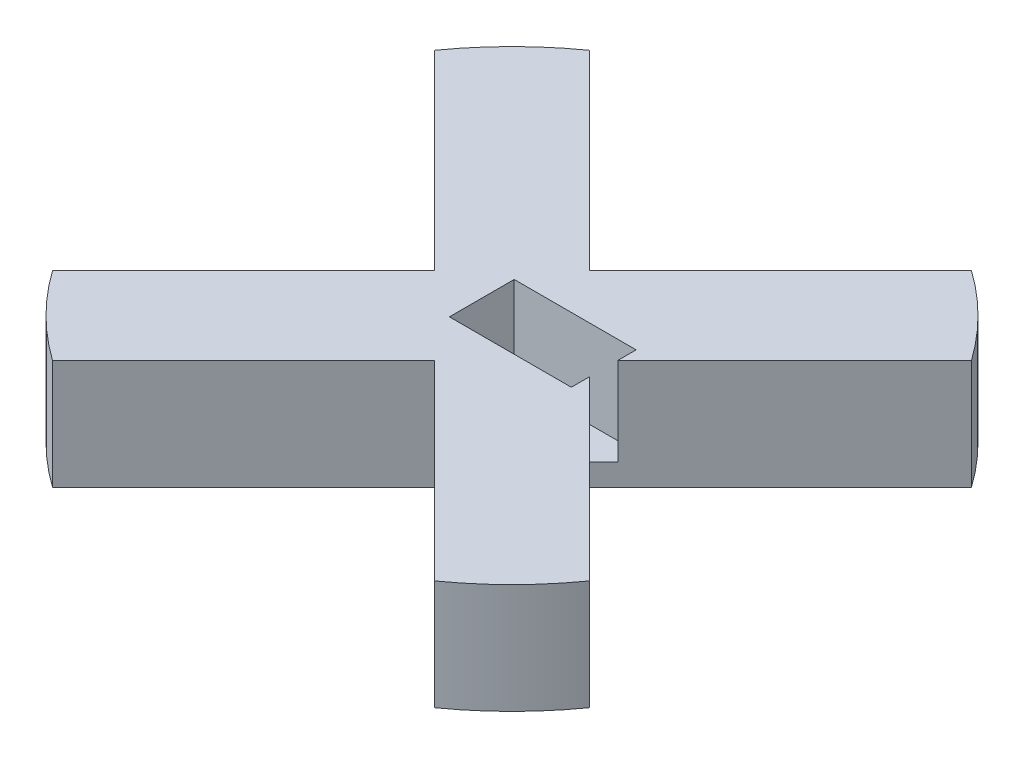
from build123d import *

# Parameters (mm, degrees)
BOSS_EXTRUDE2_DEPTH = 20
SKETCH7_W           = 22.2
SKETCH7_H           = 11.8
CUT_EXTRUDE8_DEPTH  = 16


with BuildPart() as part:
    # Sketch2 → Boss-Extrude2 (new body)
    with BuildSketch(Plane(origin=(0, 0, 0), x_dir=(1, 0, 0), z_dir=(0, 1, 0))):
        with BuildLine():
            Line((14.142135624, 0), (48.904069139, 34.761933515))
            ThreePointArc((48.904069139, 34.761933515), (42.426406871, 42.426406871), (34.761933515, 48.904069139))
            Line((34.761933515, 48.904069139), (0, 14.142135624))
            Line((0, 14.142135624), (-34.761933515, 48.904069139))
            ThreePointArc((-34.761933515, 48.904069139), (-42.426406871, 42.426406871), (-48.904069139, 34.761933515))
            Line((-48.904069139, 34.761933515), (-14.142135624, 0))
            Line((-14.142135624, 0), (-48.904069139, -34.761933515))
            ThreePointArc((-48.904069139, -34.761933515), (-42.426406871, -42.426406871), (-34.761933515, -48.904069139))
            Line((-34.761933515, -48.904069139), (0, -14.142135624))
            Line((0, -14.142135624), (34.761933515, -48.904069139))
            ThreePointArc((34.761933515, -48.904069139), (42.426406871, -42.426406871), (48.904069139, -34.761933515))
            Line((48.904069139, -34.761933515), (14.142135624, 0))
        make_face()
    extrude(amount=BOSS_EXTRUDE2_DEPTH)

    # Sketch7 → Cut-Extrude8 (cut)
    with BuildSketch(Plane(origin=(0, 20, 0), x_dir=(1, 0, 0), z_dir=(0, 1, 0))):
        with Locations((5.6, 0)):
            Rectangle(SKETCH7_W, SKETCH7_H)
    extrude(amount=-CUT_EXTRUDE8_DEPTH, mode=Mode.SUBTRACT)


solid = part.part
